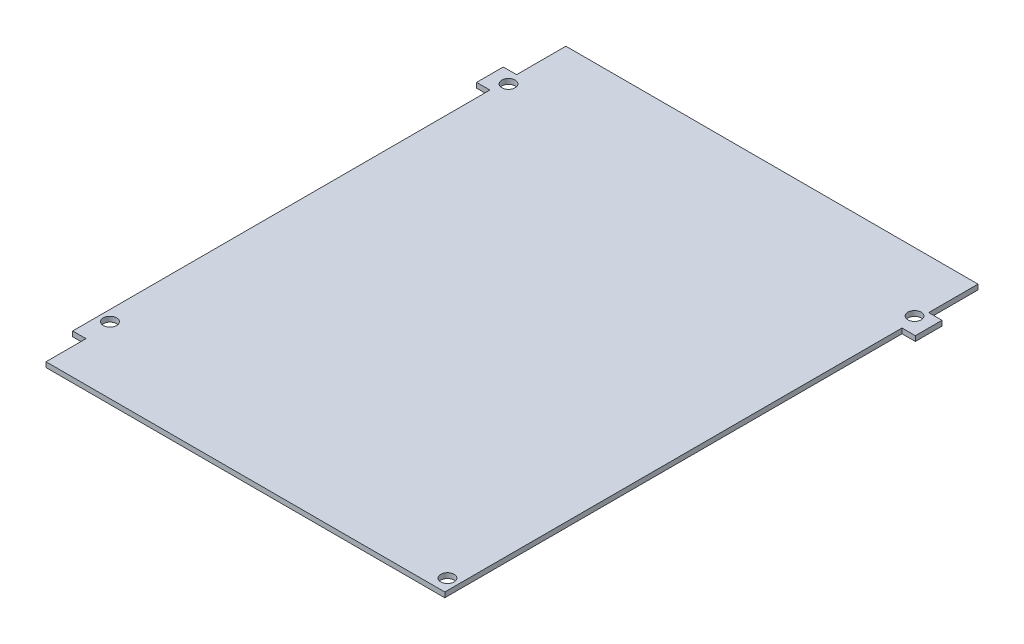
from build123d import *

# Parameters (mm, degrees)
BASE_FLANGE1_DEPTH = 1.89738
SKETCH6_R          = 2.5
CUT_EXTRUDE1_DEPTH = 1.89738
SKETCH7_W          = 5
SKETCH7_H          = 15
CUT_EXTRUDE2_DEPTH = 10


# Sheet-metal steps are written as plain solids
with BuildPart() as part:
    # Sketch1 → Base-Flange1 (new body)
    with BuildSketch(Plane(origin=(0, 0, 0), x_dir=(1, 0, 0), z_dir=(0, 1, 0))):
        Polygon((43.041223022, 34.251798561), (48.041223022, 34.251798561), (48.041223022, 24.251798561), (43.041223022, 24.251798561), (43.041223022, -147.248201439), (-111.528776978, -147.248201439), (-111.528776978, 24.251798561), (-116.528776978, 24.251798561), (-116.528776978, 34.251798561), (-111.528776978, 34.251798561), (-111.528776978, 52.751798561), (43.041223022, 52.751798561), align=None)
    extrude(amount=-BASE_FLANGE1_DEPTH)

    # Sketch6 → Cut-Extrude1 (cut)
    with BuildSketch(Plane.XZ.offset(1.89738)):
        with Locations(Location((-107.528776978, 122.248201439, 0), (0, 0, 270))):
            Circle(SKETCH6_R)
        with Locations(Location((39.041223022, 142.248201439, 0), (0, 0, 270))):
            Circle(SKETCH6_R)
        with Locations(Location((-110.028776978, -29.729970338, 0), (0, 0, 270))):
            Circle(SKETCH6_R)
        with Locations(Location((41.503528065, -30.503445529, 0), (0, 0, 270))):
            Circle(SKETCH6_R)
    extrude(amount=-CUT_EXTRUDE1_DEPTH, mode=Mode.SUBTRACT)

    # Sketch7 → Cut-Extrude2 (cut)
    with BuildSketch(Plane(origin=(0, 0, 0), x_dir=(1, 0, 0), z_dir=(0, 1, 0))):
        with Locations((-109.028776978, -139.748201439)):
            Rectangle(SKETCH7_W, SKETCH7_H)
    extrude(amount=-CUT_EXTRUDE2_DEPTH, mode=Mode.SUBTRACT)


solid = part.part
